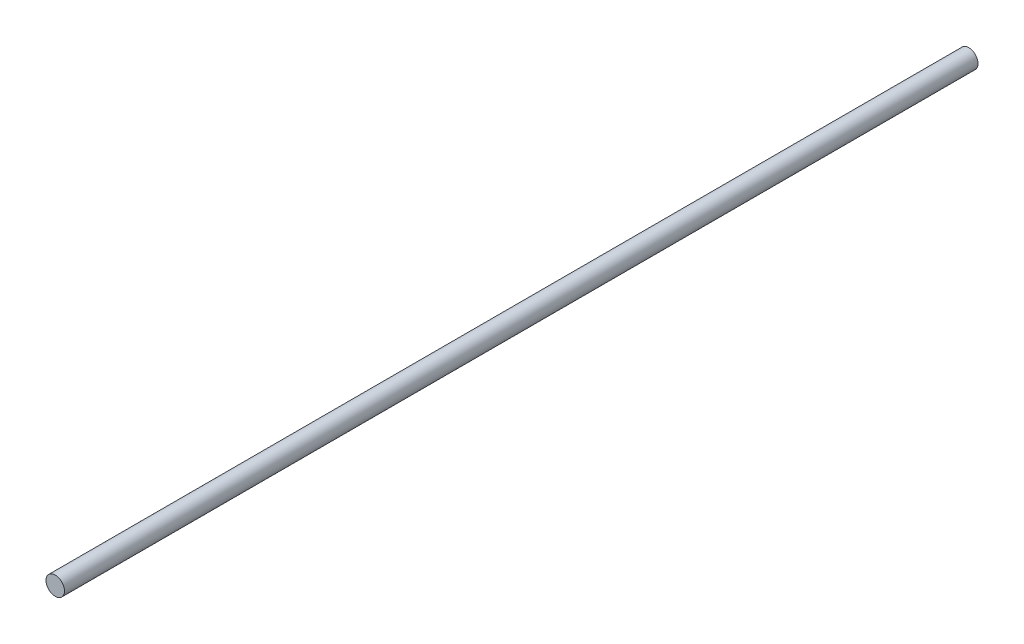
from build123d import *

# Parameters (mm, degrees)
SKETCH2_W = 395.35319436
SKETCH2_H = 4


with BuildPart() as part:
    # Sketch2 → Revolve1 (revolve)
    with BuildSketch(Plane(origin=(0, 0, 0), x_dir=(0, 0, -1), z_dir=(1, 0, 0))):
        with Locations((189.876596989, 2)):
            Rectangle(SKETCH2_W, SKETCH2_H)
    revolve(axis=Axis((0, 0, 7.800000191), (0, 0, -1)))


solid = part.part
